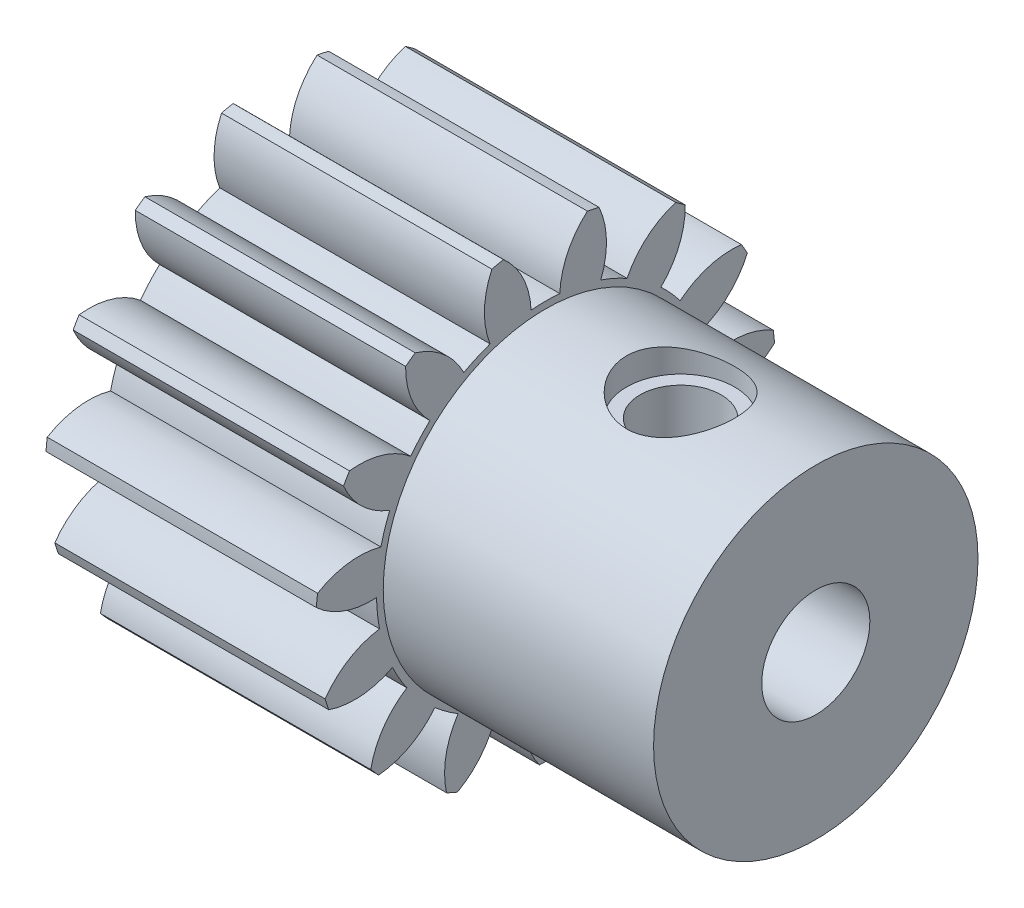
from build123d import *

# Parameters (mm, degrees)
STOCK_GEAR_1M_15T_D4_START_1_OUTLINE_R = 2
STOCK_GEAR_1M_15T_D4_START_1_DEPTH     = 10
SKETCH1_R                              = 6
SKETCH1_R_2                            = 2
BOSS_EXTRUDE1_DEPTH                    = 10
SKETCH2_R                              = 1.5
CUT_EXTRUDE2_DEPTH                     = 6
SKETCH2_3_R                            = 2
CUT_EXTRUDE3_DEPTH                     = 1


# Read off the part's stored shape, not the designer's step: Stock-Gear 1M 15T D4 Start-1
with BuildPart() as part:
    # Stock-Gear 1M 15T D4 Start-1 outline → Stock-Gear 1M 15T D4 Start-1 (new body)
    with BuildSketch(Plane.YZ):
        with BuildLine():
            ThreePointArc((1.106368468, 8.427689411), (0.888491938, 8.453436111), (0.670023493, 8.473551116))
            ThreePointArc((0.670023493, 8.473551116), (0.04560728, 7.441942771), (-0.122166634, 6.24780572))
            ThreePointArc((-0.122166634, 6.24780572), (-0.653198367, 6.214767324), (-1.179494851, 6.136676046))
            ThreePointArc((-1.179494851, 6.136676046), (-1.591877556, 7.26983618), (-2.417132211, 8.149077977))
            ThreePointArc((-2.417132211, 8.149077977), (-2.626644452, 8.083980389), (-2.834406818, 8.013497238))
            ThreePointArc((-2.834406818, 8.013497238), (-2.985246497, 6.817103167), (-2.652816299, 5.657964889))
            ThreePointArc((-2.652816299, 5.657964889), (-3.1245, 5.411792748), (-3.573533178, 5.126388751))
            ThreePointArc((-3.573533178, 5.126388751), (-4.411161274, 5.993850886), (-5.522688773, 6.461416928))
            ThreePointArc((-5.522688773, 6.461416928), (-5.687610154, 6.316731017), (-5.84874244, 6.167836888))
            ThreePointArc((-5.84874244, 6.167836888), (-5.499924035, 5.013524493), (-4.724769925, 4.089810528))
            ThreePointArc((-4.724769925, 4.089810528), (-5.055547198, 3.673070042), (-5.349675154, 3.229702268))
            ThreePointArc((-5.349675154, 3.229702268), (-6.467715133, 3.681474322), (-7.673322273, 3.656518192))
            ThreePointArc((-7.673322273, 3.656518192), (-7.76513639, 3.457261466), (-7.851777359, 3.255701506))
            ThreePointArc((-7.851777359, 3.255701506), (-7.063614741, 2.343061888), (-5.979767908, 1.814490772))
            ThreePointArc((-5.979767908, 1.814490772), (-6.112444357, 1.299240156), (-6.200809696, 0.774570923))
            ThreePointArc((-6.200809696, 0.774570923), (-7.405942289, 0.732537403), (-8.497168643, 0.219374243))
            ThreePointArc((-8.497168643, 0.219374243), (-8.5, 0), (-8.497168643, -0.219374243))
            ThreePointArc((-8.497168643, -0.219374243), (-7.405942289, -0.732537403), (-6.200809696, -0.774570923))
            ThreePointArc((-6.200809696, -0.774570923), (-6.112444357, -1.299240156), (-5.979767908, -1.814490772))
            ThreePointArc((-5.979767908, -1.814490772), (-7.063614741, -2.343061888), (-7.851777359, -3.255701506))
            ThreePointArc((-7.851777359, -3.255701506), (-7.76513639, -3.457261466), (-7.673322273, -3.656518192))
            ThreePointArc((-7.673322273, -3.656518192), (-6.467715133, -3.681474322), (-5.349675154, -3.229702268))
            ThreePointArc((-5.349675154, -3.229702268), (-5.055547198, -3.673070042), (-4.724769925, -4.089810528))
            ThreePointArc((-4.724769925, -4.089810528), (-5.499924035, -5.013524493), (-5.84874244, -6.167836888))
            ThreePointArc((-5.84874244, -6.167836888), (-5.687610154, -6.316731017), (-5.522688773, -6.461416928))
            ThreePointArc((-5.522688773, -6.461416928), (-4.411161274, -5.993850886), (-3.573533178, -5.126388751))
            ThreePointArc((-3.573533178, -5.126388751), (-3.1245, -5.411792748), (-2.652816299, -5.657964889))
            ThreePointArc((-2.652816299, -5.657964889), (-2.985246497, -6.817103167), (-2.834406818, -8.013497238))
            ThreePointArc((-2.834406818, -8.013497238), (-2.626644452, -8.083980389), (-2.417132211, -8.149077977))
            ThreePointArc((-2.417132211, -8.149077977), (-1.591877556, -7.26983618), (-1.179494851, -6.136676046))
            ThreePointArc((-1.179494851, -6.136676046), (-0.653198367, -6.214767324), (-0.122166634, -6.24780572))
            ThreePointArc((-0.122166634, -6.24780572), (0.04560728, -7.441942771), (0.670023493, -8.473551116))
            ThreePointArc((0.670023493, -8.473551116), (0.888491938, -8.453436111), (1.106368468, -8.427689411))
            ThreePointArc((1.106368468, -8.427689411), (1.502656253, -7.288800753), (1.418488851, -6.085876303))
            ThreePointArc((1.418488851, -6.085876303), (1.931047198, -5.94315217), (2.429606752, -5.757344182))
            ThreePointArc((2.429606752, -5.757344182), (3.068575145, -6.780002862), (4.058600654, -7.468451026))
            ThreePointArc((4.058600654, -7.468451026), (4.25, -7.361215932), (4.438567989, -7.249076783))
            ThreePointArc((4.438567989, -7.249076783), (4.337367144, -6.04746546), (3.771202944, -4.982773259))
            ThreePointArc((3.771202944, -4.982773259), (4.181397159, -4.643912014), (4.561279057, -4.271385532))
            ThreePointArc((4.561279057, -4.271385532), (5.560958489, -4.945738865), (6.745408891, -5.171987905))
            ThreePointArc((6.745408891, -5.171987905), (6.876644452, -4.996174644), (7.003298781, -4.817032924))
            ThreePointArc((7.003298781, -4.817032924), (6.422107853, -3.760468449), (5.471841788, -3.018103451))
            ThreePointArc((5.471841788, -3.018103451), (5.708745565, -2.541697283), (5.904264776, -2.046865518))
            ThreePointArc((5.904264776, -2.046865518), (7.091801591, -2.256311686), (8.265874651, -1.981241089))
            ThreePointArc((8.265874651, -1.981241089), (8.314254606, -1.767249372), (8.357095591, -1.55208031))
            ThreePointArc((8.357095591, -1.55208031), (7.396407771, -0.823252281), (6.226349477, -0.531576138))
            ThreePointArc((6.226349477, -0.531576138), (6.249, 0), (6.226349477, 0.531576138))
            ThreePointArc((6.226349477, 0.531576138), (7.396407771, 0.823252281), (8.357095591, 1.55208031))
            ThreePointArc((8.357095591, 1.55208031), (8.314254606, 1.767249372), (8.265874651, 1.981241089))
            ThreePointArc((8.265874651, 1.981241089), (7.091801591, 2.256311686), (5.904264776, 2.046865518))
            ThreePointArc((5.904264776, 2.046865518), (5.708745565, 2.541697283), (5.471841788, 3.018103451))
            ThreePointArc((5.471841788, 3.018103451), (6.422107853, 3.760468449), (7.003298781, 4.817032924))
            ThreePointArc((7.003298781, 4.817032924), (6.876644452, 4.996174644), (6.745408891, 5.171987905))
            ThreePointArc((6.745408891, 5.171987905), (5.560958489, 4.945738865), (4.561279057, 4.271385532))
            ThreePointArc((4.561279057, 4.271385532), (4.181397159, 4.643912014), (3.771202944, 4.982773259))
            ThreePointArc((3.771202944, 4.982773259), (4.337367144, 6.04746546), (4.438567989, 7.249076783))
            ThreePointArc((4.438567989, 7.249076783), (4.25, 7.361215932), (4.058600654, 7.468451026))
            ThreePointArc((4.058600654, 7.468451026), (3.068575145, 6.780002862), (2.429606752, 5.757344182))
            ThreePointArc((2.429606752, 5.757344182), (1.931047198, 5.94315217), (1.418488851, 6.085876303))
            ThreePointArc((1.418488851, 6.085876303), (1.502656253, 7.288800753), (1.106368468, 8.427689411))
        make_face()
        Circle(STOCK_GEAR_1M_15T_D4_START_1_OUTLINE_R, mode=Mode.SUBTRACT)
    extrude(amount=STOCK_GEAR_1M_15T_D4_START_1_DEPTH)

    # Sketch1 → Boss-Extrude1 (add)
    with BuildSketch(Plane(origin=(10, 0, 0), x_dir=(0, 0, -1), z_dir=(1, 0, 0))):
        with Locations(Location((0, 0, 0), (0, 0, 180))):
            Circle(SKETCH1_R)
        Circle(SKETCH1_R_2, mode=Mode.SUBTRACT)
    extrude(amount=BOSS_EXTRUDE1_DEPTH)

    # Sketch2 → Cut-Extrude2 (cut)
    with BuildSketch(Plane(origin=(0, 6, 0), x_dir=(1, 0, 0), z_dir=(0, 1, 0))):
        with Locations(Location((15, 0, 0), (0, 0, 270))):
            Circle(SKETCH2_R)
    extrude(amount=-CUT_EXTRUDE2_DEPTH, mode=Mode.SUBTRACT)

    # Sketch2<3> → Cut-Extrude3 (cut)
    with BuildSketch(Plane(origin=(0, 6, 0), x_dir=(1, 0, 0), z_dir=(0, 1, 0))):
        with Locations(Location((15, 0, 0), (0, 0, 270))):
            Circle(SKETCH2_3_R)
    extrude(amount=-CUT_EXTRUDE3_DEPTH, mode=Mode.SUBTRACT)


solid = part.part
